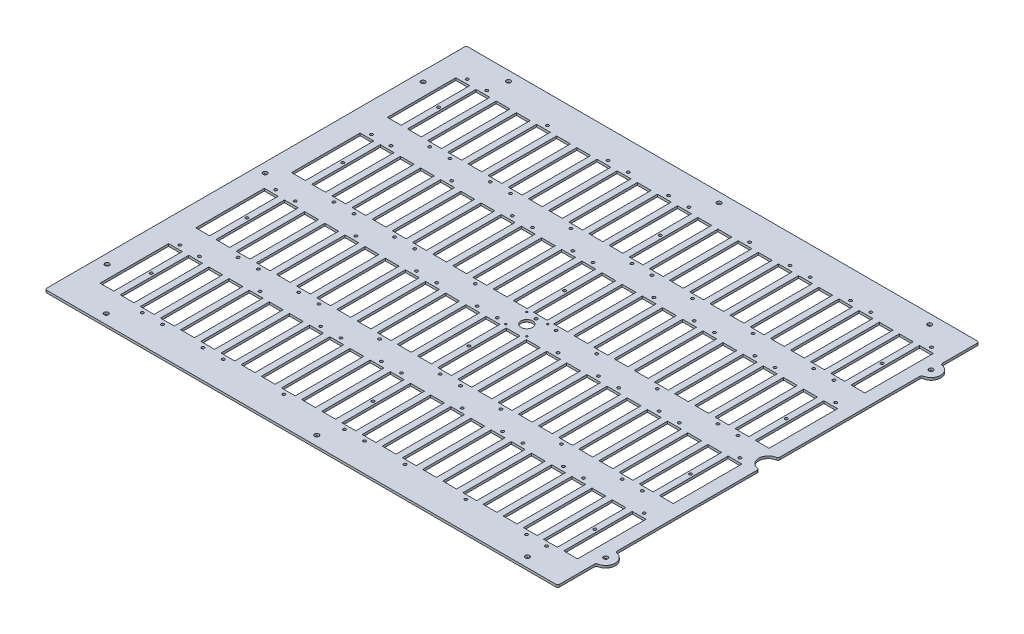
from build123d import *

# Parameters (mm, degrees)
BOSS_EXTRUDE1_DEPTH          = 3.175
SKETCH17_W                   = 18.288
SKETCH17_H                   = 90.932
CUT_EXTRUDE5_DEPTH           = 451.265762746
F_25_0_1495_DIAMETER_HOLE1_D = 3.7973
FILLET1_R                    = 2.54
F_6_CLEARANCE_HOLE1_D        = 3.7973
F_2_CLEARANCE_HOLE1_D        = 2.4384
SKETCH20_R                   = 7.62
CUT_EXTRUDE6_DEPTH           = 451.265762746
F_1_0_228_DIAMETER_HOLE1_D   = 5.7912


with BuildPart() as part:
    # Sketch1 → Boss-Extrude1 (new body)
    with BuildSketch(Plane(origin=(0, 0, 0), x_dir=(1, 0, 0), z_dir=(0, 1, 0))):
        with BuildLine():
            Line((340.2584, 228.6), (340.2584, 279.5524))
            Line((340.2584, 279.5524), (-340.2584, 279.5524))
            Line((-340.2584, 279.5524), (-340.2584, -279.5524))
            Line((-340.2584, -279.5524), (340.2584, -279.5524))
            Line((340.2584, -279.5524), (340.2584, -228.6))
            ThreePointArc((340.2584, -228.6), (352.9584, -215.9), (340.2584, -203.2))
            Line((340.2584, -203.2), (340.2584, -12.7))
            ThreePointArc((340.2584, -12.7), (327.5584, 0), (340.2584, 12.7))
            Line((340.2584, 12.7), (340.2584, 203.2))
            ThreePointArc((340.2584, 203.2), (352.9584, 215.9), (340.2584, 228.6))
        make_face()
    extrude(amount=BOSS_EXTRUDE1_DEPTH)

    # Sketch17 → Cut-Extrude5 (cut, through all)
    with BuildSketch(Plane(origin=(0, 3.175, 0), x_dir=(1, 0, 0), z_dir=(0, 1, 0))):
        with Locations((-274.696582609, 190.6524)):
            Rectangle(SKETCH17_W, SKETCH17_H)
        with Locations((-301.4472, 190.6524)):
            Rectangle(SKETCH17_W, SKETCH17_H)
        with Locations((-247.945965217, 190.6524)):
            Rectangle(SKETCH17_W, SKETCH17_H)
        with Locations((-221.195347826, 190.6524)):
            Rectangle(SKETCH17_W, SKETCH17_H)
        with Locations((-194.444730435, 190.6524)):
            Rectangle(SKETCH17_W, SKETCH17_H)
        with Locations((-167.694113043, 190.6524)):
            Rectangle(SKETCH17_W, SKETCH17_H)
        with Locations((-140.943495652, 190.6524)):
            Rectangle(SKETCH17_W, SKETCH17_H)
        with Locations((-114.192878261, 190.6524)):
            Rectangle(SKETCH17_W, SKETCH17_H)
        with Locations((-87.44226087, 190.6524)):
            Rectangle(SKETCH17_W, SKETCH17_H)
        with Locations((-60.691643478, 190.6524)):
            Rectangle(SKETCH17_W, SKETCH17_H)
        with Locations((-33.941026087, 190.6524)):
            Rectangle(SKETCH17_W, SKETCH17_H)
        with Locations((-7.190408696, 190.6524)):
            Rectangle(SKETCH17_W, SKETCH17_H)
        with Locations((19.560208696, 190.6524)):
            Rectangle(SKETCH17_W, SKETCH17_H)
        with Locations((46.310826087, 190.6524)):
            Rectangle(SKETCH17_W, SKETCH17_H)
        with Locations((73.061443478, 190.6524)):
            Rectangle(SKETCH17_W, SKETCH17_H)
        with Locations((99.81206087, 190.6524)):
            Rectangle(SKETCH17_W, SKETCH17_H)
        with Locations((126.562678261, 190.6524)):
            Rectangle(SKETCH17_W, SKETCH17_H)
        with Locations((153.313295652, 190.6524)):
            Rectangle(SKETCH17_W, SKETCH17_H)
        with Locations((180.063913043, 190.6524)):
            Rectangle(SKETCH17_W, SKETCH17_H)
        with Locations((206.814530435, 190.6524)):
            Rectangle(SKETCH17_W, SKETCH17_H)
        with Locations((233.565147826, 190.6524)):
            Rectangle(SKETCH17_W, SKETCH17_H)
        with Locations((260.315765217, 190.6524)):
            Rectangle(SKETCH17_W, SKETCH17_H)
        with Locations((287.066382609, 190.6524)):
            Rectangle(SKETCH17_W, SKETCH17_H)
        with Locations((313.817, 190.6524)):
            Rectangle(SKETCH17_W, SKETCH17_H)
        with Locations((-274.696582609, 63.5762)):
            Rectangle(SKETCH17_W, SKETCH17_H)
        with Locations((-247.945965217, 63.5762)):
            Rectangle(SKETCH17_W, SKETCH17_H)
        with Locations((-221.195347826, 63.5762)):
            Rectangle(SKETCH17_W, SKETCH17_H)
        with Locations((-194.444730435, 63.5762)):
            Rectangle(SKETCH17_W, SKETCH17_H)
        with Locations((-167.694113043, 63.5762)):
            Rectangle(SKETCH17_W, SKETCH17_H)
        with Locations((-140.943495652, 63.5762)):
            Rectangle(SKETCH17_W, SKETCH17_H)
        with Locations((-114.192878261, 63.5762)):
            Rectangle(SKETCH17_W, SKETCH17_H)
        with Locations((-87.44226087, 63.5762)):
            Rectangle(SKETCH17_W, SKETCH17_H)
        with Locations((-60.691643478, 63.5762)):
            Rectangle(SKETCH17_W, SKETCH17_H)
        with Locations((-33.941026087, 63.5762)):
            Rectangle(SKETCH17_W, SKETCH17_H)
        with Locations((-7.190408696, 63.5762)):
            Rectangle(SKETCH17_W, SKETCH17_H)
        with Locations((19.560208696, 63.5762)):
            Rectangle(SKETCH17_W, SKETCH17_H)
        with Locations((46.310826087, 63.5762)):
            Rectangle(SKETCH17_W, SKETCH17_H)
        with Locations((73.061443478, 63.5762)):
            Rectangle(SKETCH17_W, SKETCH17_H)
        with Locations((99.81206087, 63.5762)):
            Rectangle(SKETCH17_W, SKETCH17_H)
        with Locations((126.562678261, 63.5762)):
            Rectangle(SKETCH17_W, SKETCH17_H)
        with Locations((153.313295652, 63.5762)):
            Rectangle(SKETCH17_W, SKETCH17_H)
        with Locations((180.063913043, 63.5762)):
            Rectangle(SKETCH17_W, SKETCH17_H)
        with Locations((206.814530435, 63.5762)):
            Rectangle(SKETCH17_W, SKETCH17_H)
        with Locations((233.565147826, 63.5762)):
            Rectangle(SKETCH17_W, SKETCH17_H)
        with Locations((260.315765217, 63.5762)):
            Rectangle(SKETCH17_W, SKETCH17_H)
        with Locations((287.066382609, 63.5762)):
            Rectangle(SKETCH17_W, SKETCH17_H)
        with Locations((313.817, 63.5762)):
            Rectangle(SKETCH17_W, SKETCH17_H)
        with Locations((-274.696582609, -63.5)):
            Rectangle(SKETCH17_W, SKETCH17_H)
        with Locations((-247.945965217, -63.5)):
            Rectangle(SKETCH17_W, SKETCH17_H)
        with Locations((-221.195347826, -63.5)):
            Rectangle(SKETCH17_W, SKETCH17_H)
        with Locations((-194.444730435, -63.5)):
            Rectangle(SKETCH17_W, SKETCH17_H)
        with Locations((-167.694113043, -63.5)):
            Rectangle(SKETCH17_W, SKETCH17_H)
        with Locations((-140.943495652, -63.5)):
            Rectangle(SKETCH17_W, SKETCH17_H)
        with Locations((-114.192878261, -63.5)):
            Rectangle(SKETCH17_W, SKETCH17_H)
        with Locations((-87.44226087, -63.5)):
            Rectangle(SKETCH17_W, SKETCH17_H)
        with Locations((-60.691643478, -63.5)):
            Rectangle(SKETCH17_W, SKETCH17_H)
        with Locations((-33.941026087, -63.5)):
            Rectangle(SKETCH17_W, SKETCH17_H)
        with Locations((-7.190408696, -63.5)):
            Rectangle(SKETCH17_W, SKETCH17_H)
        with Locations((19.560208696, -63.5)):
            Rectangle(SKETCH17_W, SKETCH17_H)
        with Locations((46.310826087, -63.5)):
            Rectangle(SKETCH17_W, SKETCH17_H)
        with Locations((73.061443478, -63.5)):
            Rectangle(SKETCH17_W, SKETCH17_H)
        with Locations((99.81206087, -63.5)):
            Rectangle(SKETCH17_W, SKETCH17_H)
        with Locations((126.562678261, -63.5)):
            Rectangle(SKETCH17_W, SKETCH17_H)
        with Locations((153.313295652, -63.5)):
            Rectangle(SKETCH17_W, SKETCH17_H)
        with Locations((180.063913043, -63.5)):
            Rectangle(SKETCH17_W, SKETCH17_H)
        with Locations((206.814530435, -63.5)):
            Rectangle(SKETCH17_W, SKETCH17_H)
        with Locations((233.565147826, -63.5)):
            Rectangle(SKETCH17_W, SKETCH17_H)
        with Locations((260.315765217, -63.5)):
            Rectangle(SKETCH17_W, SKETCH17_H)
        with Locations((287.066382609, -63.5)):
            Rectangle(SKETCH17_W, SKETCH17_H)
        with Locations((313.817, -63.5)):
            Rectangle(SKETCH17_W, SKETCH17_H)
        with Locations((-274.696582609, -190.5762)):
            Rectangle(SKETCH17_W, SKETCH17_H)
        with Locations((-247.945965217, -190.5762)):
            Rectangle(SKETCH17_W, SKETCH17_H)
        with Locations((-221.195347826, -190.5762)):
            Rectangle(SKETCH17_W, SKETCH17_H)
        with Locations((-194.444730435, -190.5762)):
            Rectangle(SKETCH17_W, SKETCH17_H)
        with Locations((-167.694113043, -190.5762)):
            Rectangle(SKETCH17_W, SKETCH17_H)
        with Locations((-140.943495652, -190.5762)):
            Rectangle(SKETCH17_W, SKETCH17_H)
        with Locations((-114.192878261, -190.5762)):
            Rectangle(SKETCH17_W, SKETCH17_H)
        with Locations((-87.44226087, -190.5762)):
            Rectangle(SKETCH17_W, SKETCH17_H)
        with Locations((-60.691643478, -190.5762)):
            Rectangle(SKETCH17_W, SKETCH17_H)
        with Locations((-33.941026087, -190.5762)):
            Rectangle(SKETCH17_W, SKETCH17_H)
        with Locations((-7.190408696, -190.5762)):
            Rectangle(SKETCH17_W, SKETCH17_H)
        with Locations((19.560208696, -190.5762)):
            Rectangle(SKETCH17_W, SKETCH17_H)
        with Locations((46.310826087, -190.5762)):
            Rectangle(SKETCH17_W, SKETCH17_H)
        with Locations((73.061443478, -190.5762)):
            Rectangle(SKETCH17_W, SKETCH17_H)
        with Locations((99.81206087, -190.5762)):
            Rectangle(SKETCH17_W, SKETCH17_H)
        with Locations((126.562678261, -190.5762)):
            Rectangle(SKETCH17_W, SKETCH17_H)
        with Locations((153.313295652, -190.5762)):
            Rectangle(SKETCH17_W, SKETCH17_H)
        with Locations((180.063913043, -190.5762)):
            Rectangle(SKETCH17_W, SKETCH17_H)
        with Locations((206.814530435, -190.5762)):
            Rectangle(SKETCH17_W, SKETCH17_H)
        with Locations((233.565147826, -190.5762)):
            Rectangle(SKETCH17_W, SKETCH17_H)
        with Locations((260.315765217, -190.5762)):
            Rectangle(SKETCH17_W, SKETCH17_H)
        with Locations((287.066382609, -190.5762)):
            Rectangle(SKETCH17_W, SKETCH17_H)
        with Locations((313.817, -190.5762)):
            Rectangle(SKETCH17_W, SKETCH17_H)
        with Locations((-301.4472, 63.5762)):
            Rectangle(SKETCH17_W, SKETCH17_H)
        with Locations((-301.4472, -63.5)):
            Rectangle(SKETCH17_W, SKETCH17_H)
        with Locations((-301.4472, -190.5762)):
            Rectangle(SKETCH17_W, SKETCH17_H)
    extrude(amount=-CUT_EXTRUDE5_DEPTH, mode=Mode.SUBTRACT)

    # #25 (0.1495) Diameter Hole1 (through all)
    with Locations(Plane(origin=(0, 3.175, 0), x_dir=(1, 0, 0), z_dir=(0, 1, 0))):
        with Locations((287.8201, -241.8842), (-301.4472, 241.9604), (-275.4503, 241.9604), (-194.9831, 241.9604), (-114.5159, 241.9604), (-87.6935, 241.9604), (-34.0487, 241.9604), (-7.2263, 241.9604), (73.2409, 241.9604), (126.8857, 241.9604), (153.7081, 241.9604), (207.3529, 241.9604), (234.1753, 241.9604), (314.6425, 241.9604), (-248.6279, 139.3444), (-221.8055, 139.3444), (-168.1607, 139.3444), (-141.3383, 139.3444), (-60.8711, 139.3444), (19.5961, 139.3444), (46.4185, 139.3444), (100.0633, 139.3444), (180.5305, 139.3444), (260.9977, 139.3444), (287.8201, 139.3444), (-301.4472, 114.8842), (-275.4503, 114.8842), (-194.9831, 114.8842), (-114.5159, 114.8842), (-87.6935, 114.8842), (-34.0487, 114.8842), (-7.2263, 114.8842), (73.2409, 114.8842), (126.8857, 114.8842), (153.7081, 114.8842), (207.3529, 114.8842), (234.1753, 114.8842), (314.6425, 114.8842), (-248.6279, 12.2682), (-221.8055, 12.2682), (-168.1607, 12.2682), (-141.3383, 12.2682), (-60.8711, 12.2682), (19.5961, 12.2682), (46.4185, 12.2682), (100.0633, 12.2682), (180.5305, 12.2682), (260.9977, 12.2682), (287.8201, 12.2682), (-301.4472, -12.192), (-275.4503, -12.192), (-194.9831, -12.192), (-114.5159, -12.192), (-87.6935, -12.192), (-34.0487, -12.192), (-7.2263, -12.192), (73.2409, -12.192), (126.8857, -12.192), (153.7081, -12.192), (207.3529, -12.192), (234.1753, -12.192), (314.6425, -12.192), (-248.6279, -114.808), (-221.8055, -114.808), (-168.1607, -114.808), (-141.3383, -114.808), (-60.8711, -114.808), (19.5961, -114.808), (46.4185, -114.808), (100.0633, -114.808), (180.5305, -114.808), (260.9977, -114.808), (287.8201, -114.808), (-301.4472, -139.2682), (-275.4503, -139.2682), (-194.9831, -139.2682), (-114.5159, -139.2682), (-87.6935, -139.2682), (-34.0487, -139.2682), (-7.2263, -139.2682), (73.2409, -139.2682), (126.8857, -139.2682), (153.7081, -139.2682), (207.3529, -139.2682), (234.1753, -139.2682), (314.6425, -139.2682), (-248.6279, -241.8842), (-221.8055, -241.8842), (-168.1607, -241.8842), (-141.3383, -241.8842), (-60.8711, -241.8842), (19.5961, -241.8842), (46.4185, -241.8842), (100.0633, -241.8842), (180.5305, -241.8842), (260.9977, -241.8842)):
            Hole(F_25_0_1495_DIAMETER_HOLE1_D / 2)

    # Fillet1
    fillet1_edges = [part.edges().sort_by_distance(p)[0] for p in [
        (-340.2584, 1.5875, -279.5524),
        (-340.2584, 1.5875, 279.5524),
        (340.2584, 1.5875, 279.5524),
        (340.2584, 1.5875, 228.6),
        (340.2584, 1.5875, 203.2),
        (340.2584, 1.5875, 12.7),
        (340.2584, 1.5875, -12.7),
        (340.2584, 1.5875, -203.2),
        (340.2584, 1.5875, -279.5524),
        (340.2584, 1.5875, -228.6),
    ]]
    fillet(fillet1_edges, radius=FILLET1_R)

    # #6 Clearance Hole1 (through all)
    with Locations(Plane(origin=(0, 3.175, 0), x_dir=(1, 0, 0), z_dir=(0, 1, 0))):
        with Locations((300.441691304, -190.5762), (-288.071891304, 190.6524), (6.1849, 190.6524), (300.441691304, 190.6524), (-288.071891304, 63.5762), (6.1849, 63.5762), (300.441691304, 63.5762), (-288.071891304, -63.5), (6.1849, -63.5), (300.441691304, -63.5), (-288.071891304, -190.5762), (6.1849, -190.5762)):
            Hole(F_6_CLEARANCE_HOLE1_D / 2)

    # #2 Clearance Hole1 (through all)
    with Locations(Plane(origin=(0, 3.175, 0), x_dir=(1, 0, 0), z_dir=(0, 1, 0))):
        with Locations((33.5661, 14.0081), (5.6261, 14.0081), (5.6261, -13.9319), (33.5661, -13.9319)):
            Hole(F_2_CLEARANCE_HOLE1_D / 2)

    # Sketch20 → Cut-Extrude6 (cut, through all)
    with BuildSketch(Plane(origin=(0, 3.175, 0), x_dir=(1, 0, 0), z_dir=(0, 1, 0))):
        with Locations((19.5961, 0.0381)):
            Circle(SKETCH20_R)
    extrude(amount=-CUT_EXTRUDE6_DEPTH, mode=Mode.SUBTRACT)

    # #1 (0.228) Diameter Hole1 (through all)
    with Locations(Plane(origin=(0, 3.175, 0), x_dir=(1, 0, 0), z_dir=(0, 1, 0))):
        with Locations((287.274, -266.8524), (340.2584, -215.9), (340.2584, 0), (340.2584, 215.9), (287.274, 266.8524), (7.874, 266.8524), (-271.526, 266.8524), (-327.5584, 209.55), (-327.5584, 0), (-327.5584, -209.55), (-271.526, -266.8524), (7.874, -266.8524)):
            Hole(F_1_0_228_DIAMETER_HOLE1_D / 2)


solid = part.part
